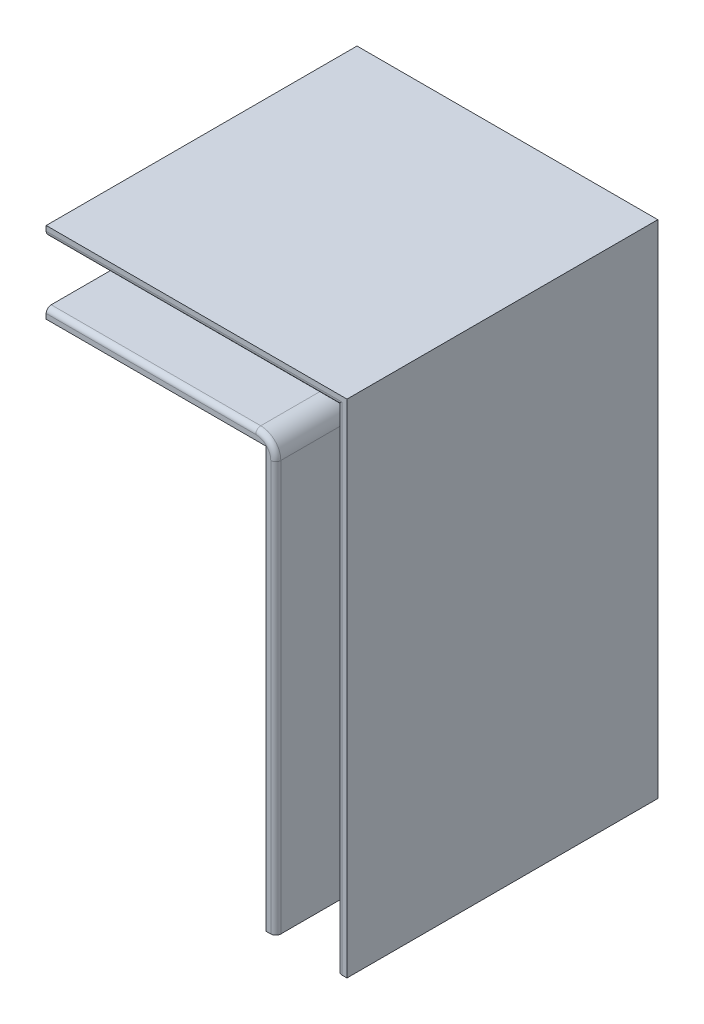
from build123d import *

# Parameters (mm, degrees)
SKETCH1_W           = 30
SKETCH1_H           = 50
BOSS_EXTRUDE1_DEPTH = 1
BOSS_EXTRUDE2_DEPTH = 30
FILLET1_R           = 2
FILLET2_R           = 0.5


with BuildPart() as part:
    # Sketch1 → Boss-Extrude1 (new body)
    with BuildSketch(Plane.XY):
        with Locations((15, 25)):
            Rectangle(SKETCH1_W, SKETCH1_H)
    extrude(amount=BOSS_EXTRUDE1_DEPTH)

    # Sketch2 → Boss-Extrude2 (add)
    with BuildSketch(Plane.XY.offset(1)):
        Polygon((0, 50), (30, 50), (30, 49), (30, 0), (29, 0), (29, 49), (0, 49), align=None)
        Polygon((0, 42.9), (22.9, 42.9), (22.9, 41.9), (22.9, 0), (21.9, 0), (21.9, 41.9), (0, 41.9), align=None)
    extrude(amount=BOSS_EXTRUDE2_DEPTH)

    # Fillet1
    fillet1_edges = [part.edges().sort_by_distance(p)[0] for p in [
        (22.9, 42.9, 16),
        (29, 24.5, 1),
        (22.9, 21.45, 1),
        (14.5, 49, 1),
        (11.45, 42.9, 1),
        (10.95, 41.9, 1),
        (21.9, 20.95, 1),
    ]]
    fillet(fillet1_edges, radius=FILLET1_R)

    # Fillet2
    fillet2_edges = [part.edges().sort_by_distance(p)[0] for p in [
        (10.45, 42.9, 31),
        (22.314213562, 42.314213562, 31),
        (14.5, 49, 31),
        (22.9, 20.45, 31),
        (29, 24.5, 31),
    ]]
    fillet(fillet2_edges, radius=FILLET2_R)


solid = part.part
